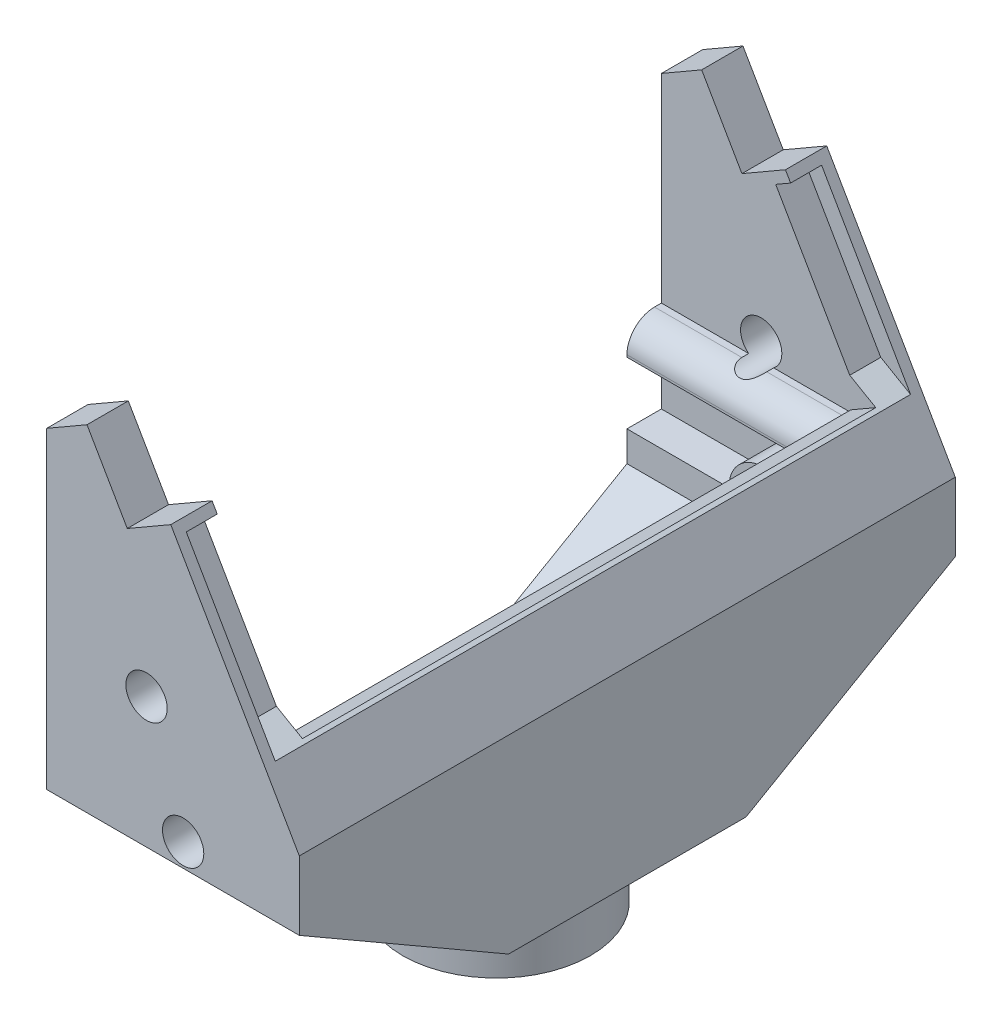
from build123d import *

# Parameters (mm, degrees)
EXTRUDE_1_DEPTH         = 18.35
CUT_EXTRUDE_1_DEPTH     = 95.3
SHELL1_START            = -41.65
SHELL1_DEPTH            = 83.3
SHELL1_START_2          = -18.35
SHELL1_2_DEPTH          = 32.2
CUT_EXTRUDE_2_REACH     = 121.678
SKETCH_5_R              = 13.65
EXTRUDE_2_DEPTH         = 11.5
CUT_EXTRUDE1_DEPTH      = 92.3
SKETCH4_W               = 83.3
SKETCH4_H               = 26.8
CUT_EXTRUDE2_DEPTH      = 4.5
M24_TAPPED_HOLE2_D      = 21
M24_TAPPED_HOLE2_DEPTH  = 16
M24_TAPPED_HOLE2_TIP    = 6.3090365
HOLEWZD2_D              = 22
HOLEWZD2_DEPTH          = 11
SKETCH20_W              = 14.821429848
SKETCH20_H              = 1.5
SKETCH20_W_2            = 17.378570152
BOSS_EXTRUDE2_DEPTH     = 5
FILLET1_R               = 1.5
FILLET2_R               = 4
SKETCH21_W              = 32.2
SKETCH21_H              = 2.401923789
BOSS_EXTRUDE3_DEPTH     = 2
FILLET1_OF_MIRROR1_R    = 1.5
FILLET2_OF_MIRROR1_R    = 4
CUT_EXTRUDE3_DEPTH      = 113.771632022
CUT_EXTRUDE3_DEPTH_BACK = 113.771632022
SKETCH22_R              = 3
FILLET3_R               = 5
CUT_EXTRUDE4_DEPTH      = 109.855137726
CUT_EXTRUDE4_DEPTH_BACK = 109.855137726
SKETCH23_R              = 3


with BuildPart() as part:
    # Эскиз2 → Бобышка-Вытянуть1 (new, symmetric)
    with BuildSketch(Plane(origin=(0, 0, 0), x_dir=(0, 0, -1), z_dir=(1, 0, 0))):
        Polygon((-17.25, 0), (17.25, 0), (47.65, 17.551448183), (47.65, 87.222990915), (-47.65, 87.222990915), (-47.65, 17.551448183), align=None)
    extrude(amount=EXTRUDE_1_DEPTH, both=True)

    # Эскиз3 → Вырез-Вытянуть1 (cut)
    with BuildSketch(Plane(origin=(0, 0, -47.65), x_dir=(-1, 0, 0), z_dir=(0, 0, -1))):
        Polygon((-18.35, 87.222990915), (-18.35, 27.551448183), (6.1746732, 70.029428205), (18.35, 63), (18.35, 87.222990915), align=None)
    extrude(amount=-CUT_EXTRUDE_1_DEPTH, mode=Mode.SUBTRACT)

    # Shell1: read off the stored shape, not the designer's step
    # Shell1 outline → Shell1 (cut)
    with BuildSketch(Plane.XY.offset(SHELL1_START)):
        Polygon((-18.35, 4.5), (13.85, 4.5), (13.85, 26.345676817), (-10.071787517, 67.779428205), (-18.35, 63), align=None)
    extrude(amount=SHELL1_DEPTH, mode=Mode.SUBTRACT)

    # Shell1 2 outline → Shell1 2 (add)
    with BuildSketch(Plane.YZ.offset(SHELL1_START_2)):
        Polygon((19.283498991, -41.65), (4.5, -16.044228634), (4.5, -25.044228634), (14.087346568, -41.65), align=None)
        Polygon((14.087346568, 41.65), (4.5, 25.044228634), (4.5, 16.044228634), (19.283498991, 41.65), align=None)
    extrude(amount=SHELL1_2_DEPTH)

    # Вырез-Вытянуть2: up to this face of the body (flat: up to its plane)
    cut_extrude_2_end = Plane(part.part.faces().sort_by_distance((-3.441629471, 38.42100508, 47.65))[0])
    # Эскиз4 → Вырез-Вытянуть2 (cut, up to the picked face)
    with BuildSketch(Plane(origin=(0, 0, -47.65), x_dir=(-1, 0, 0), z_dir=(0, 0, -1)), mode=Mode.PRIVATE) as cut_extrude_2_sk1:
        Polygon((6.1746732, 70.029428205), (12.496658648, 66.379428205), (6.646658648, 56.246930981), (0.3246732, 59.896930981), align=None)
    cut_extrude_2_tool1 = split(extrude(cut_extrude_2_sk1.sketch, amount=-CUT_EXTRUDE_2_REACH, mode=Mode.PRIVATE), bisect_by=cut_extrude_2_end, keep=Keep.BOTH, mode=Mode.PRIVATE)
    add(cut_extrude_2_tool1.solids().sort_by(Axis((-6.410666, 63.13818, -47.65), (0, 0, 1)))[0], mode=Mode.SUBTRACT)

    # Эскиз5 → Бобышка-Вытянуть2 (add)
    with BuildSketch(Plane.XZ):
        with Locations(Location((-0.65, 0, 0), (0, 0, 270))):
            Circle(SKETCH_5_R)
    extrude(amount=EXTRUDE_2_DEPTH)

    # Sketch3 → Cut-Extrude1 (cut)
    with BuildSketch(Plane.XY.offset(46.15)):
        Polygon((13.35, 36.211702221), (0.4253268, 58.597892875), (-1.73973671, 57.347892875), (9.019872981, 38.711702221), align=None)
    extrude(amount=-CUT_EXTRUDE1_DEPTH, mode=Mode.SUBTRACT)

    # Sketch4 → Cut-Extrude2 (cut)
    with BuildSketch(Plane(origin=(25.692627019, 14.833645126, 0), x_dir=(0, 0, -1), z_dir=(0.8660254037844454, 0.4999999999999885, 0))):
        with Locations((0, 38.634600438)):
            Rectangle(SKETCH4_W, SKETCH4_H)
    extrude(amount=-CUT_EXTRUDE2_DEPTH, mode=Mode.SUBTRACT)

    # M24 Tapped Hole2
    with Locations(Plane(origin=(0, -11.5, 0), x_dir=(-1, 0, 0), z_dir=(0, -1, 0))):
        with Locations((0.65, 0)):
            Hole(M24_TAPPED_HOLE2_D / 2, depth=M24_TAPPED_HOLE2_DEPTH)
            with Locations((0, 0, -(M24_TAPPED_HOLE2_DEPTH + M24_TAPPED_HOLE2_TIP / 2))):  # 118° drill point
                Cone(0, M24_TAPPED_HOLE2_D / 2, M24_TAPPED_HOLE2_TIP, mode=Mode.SUBTRACT)

    # HoleWzd2
    with Locations(Plane(origin=(-0.65, -11.5, 0), x_dir=(0, 0, -1), z_dir=(0, -1, 0))):
        with Locations((0, 0)):
            Hole(HOLEWZD2_D / 2, depth=HOLEWZD2_DEPTH)

    # Sketch20 → Boss-Extrude2 (add)
    with BuildSketch(Plane.XY.offset(-41.65)):
        with Locations((-10.939285076, 18.533498991)):
            Rectangle(SKETCH20_W, SKETCH20_H)
        with Locations((-10.939285076, 20.033498991)):
            Rectangle(SKETCH20_W, SKETCH20_H)
        Polygon((-3.528570152, 25.891773598), (-3.528570152, 20.783498991), (13.85, 20.783498991), (13.85, 25.891773598), (10.503833111, 25.891773598), align=None)
        Polygon((11.860101568, 29.792282004), (8.251873533, 29.792282004), (10.503833111, 25.891773598), (13.85, 25.891773598), (13.85, 26.345676817), align=None)
        Polygon((-18.35, 34.110173911), (-18.35, 29.792282004), (8.251873533, 29.792282004), (11.860101568, 29.792282004), (9.367165513, 34.110173911), align=None)
        with Locations((5.160714924, 18.533498991)):
            Rectangle(SKETCH20_W_2, SKETCH20_H)
        with Locations((5.160714924, 20.033498991)):
            Rectangle(SKETCH20_W_2, SKETCH20_H)
    boss_extrude2 = extrude(amount=BOSS_EXTRUDE2_DEPTH)

    # Fillet1
    fillet1_edges = [part.edges().sort_by_distance(p)[0] for p in [
        (10.503833111, 25.891773598, -39.15),
        (8.251873533, 29.792282004, -39.15),
    ]]
    fillet(fillet1_edges, radius=FILLET1_R)

    # Fillet2
    fillet2_edges = [part.edges().sort_by_distance(p)[0] for p in [
        (-4.491417244, 34.110173911, -36.65),
    ]]
    fillet(fillet2_edges, radius=FILLET2_R)

    # Sketch21 → Boss-Extrude3 (add)
    with BuildSketch(Plane.XZ.offset(-17.783498991)):
        with Locations((-2.25, -37.850961895)):
            Rectangle(SKETCH21_W, SKETCH21_H)
    boss_extrude3 = extrude(amount=BOSS_EXTRUDE3_DEPTH)

    # Mirror1: Boss-Extrude2, Boss-Extrude3 across plane
    add(boss_extrude2.mirror(Plane.XY))
    add(boss_extrude3.mirror(Plane.XY))

    # Fillet1 of Mirror1
    fillet1_of_mirror1_edges = [part.edges().sort_by_distance(p)[0] for p in [
        (10.503833111, 25.891773598, 39.15),
        (8.251873533, 29.792282004, 39.15),
    ]]
    fillet(fillet1_of_mirror1_edges, radius=FILLET1_OF_MIRROR1_R)

    # Fillet2 of Mirror1
    fillet2_of_mirror1_edges = [part.edges().sort_by_distance(p)[0] for p in [
        (-4.491417244, 34.110173911, 36.65),
    ]]
    fillet(fillet2_of_mirror1_edges, radius=FILLET2_OF_MIRROR1_R)

    # Sketch22 → Cut-Extrude3 (cut, two sides: drawn at the far end of the back side and taken through both)
    with BuildSketch(Plane.XY.offset(-41.65).offset(-CUT_EXTRUDE3_DEPTH_BACK)):
        with Locations((-3.85, 36.499622644)):
            Circle(SKETCH22_R)
    extrude(amount=CUT_EXTRUDE3_DEPTH + CUT_EXTRUDE3_DEPTH_BACK, mode=Mode.SUBTRACT)

    # Fillet3
    fillet3_edges = [part.edges().sort_by_distance(p)[0] for p in [
        (-3.528570152, 25.891773598, -39.15),
    ]]
    fillet(fillet3_edges, radius=FILLET3_R)

    # Sketch23 → Cut-Extrude4 (cut, two sides: drawn at the far end of the back side and taken through both)
    with BuildSketch(Plane.XY.offset(-36.65).offset(-CUT_EXTRUDE4_DEPTH_BACK)):
        with Locations((1.471429848, 20.891773598)):
            Circle(SKETCH23_R)
    extrude(amount=CUT_EXTRUDE4_DEPTH + CUT_EXTRUDE4_DEPTH_BACK, mode=Mode.SUBTRACT)


solid = part.part
